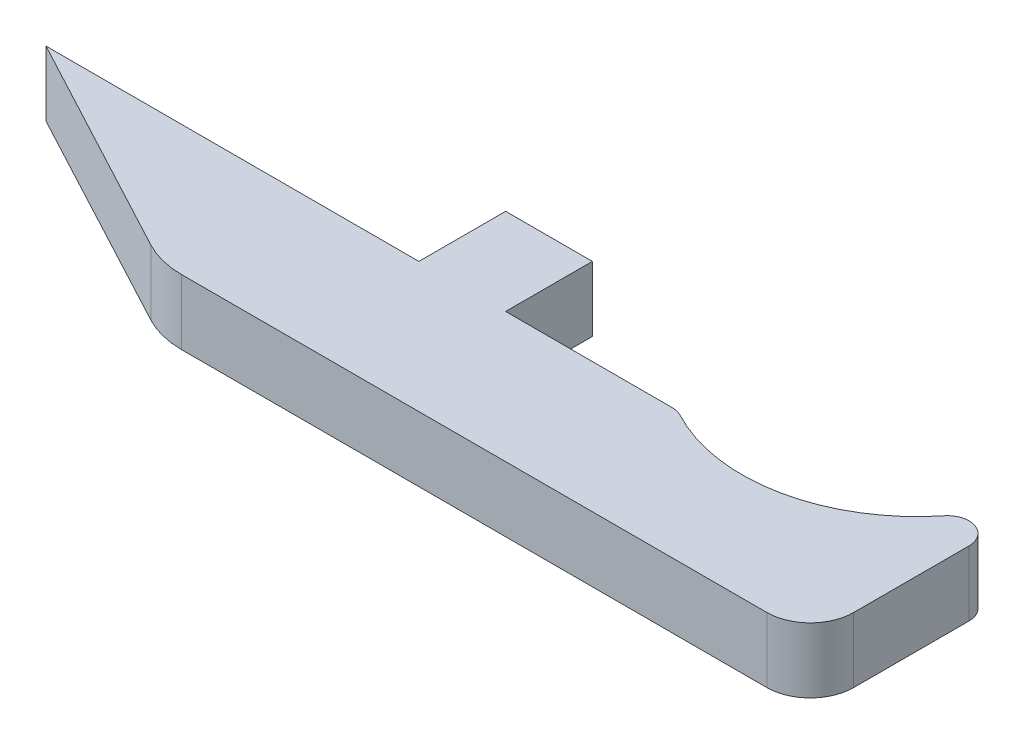
from build123d import *

# Parameters (mm, degrees)
BOSS_EXTRUDE1_DEPTH = 4.7625
FILLET1_R           = 1.5875
FILLET2_R           = 6.35
FILLET3_R           = 3.175
SKETCH2_W           = 6.35
SKETCH2_H           = 4.7625
BOSS_EXTRUDE2_DEPTH = 6.35


with BuildPart() as part:
    # Sketch1 → Boss-Extrude1 (new body)
    with BuildSketch(Plane(origin=(0, 0, 0), x_dir=(1, 0, 0), z_dir=(0, 1, 0))):
        with BuildLine():
            ThreePointArc((71.770239996, -32.203530992), (65.371223106, -43.30366442), (52.558738922, -43.328730992))
            Line((52.558738922, -43.328730992), (6.2845, -43.328730992))
            Line((6.2845, -43.328730992), (24.145239996, -52.853730992))
            Line((24.145239996, -52.853730992), (71.770239996, -52.853730992))
            Line((71.770239996, -52.853730992), (71.770239996, -32.203530992))
        make_face()
    extrude(amount=BOSS_EXTRUDE1_DEPTH)

    # Fillet1
    fillet1_edges = [part.edges().sort_by_distance(p)[0] for p in [
        (52.558738922, 2.38125, 43.328730992),
        (71.770239996, 2.38125, 32.203530992),
    ]]
    fillet(fillet1_edges, radius=FILLET1_R)

    # Fillet2
    fillet2_edges = [part.edges().sort_by_distance(p)[0] for p in [
        (24.145239996, 2.38125, 52.853730992),
    ]]
    fillet(fillet2_edges, radius=FILLET2_R)

    # Fillet3
    fillet3_edges = [part.edges().sort_by_distance(p)[0] for p in [
        (71.770239996, 2.38125, 52.853730992),
    ]]
    fillet(fillet3_edges, radius=FILLET3_R)

    # Sketch2 → Boss-Extrude2 (add)
    with BuildSketch(Plane(origin=(0, 0, 43.328730992), x_dir=(-1, 0, 0), z_dir=(0, 0, -1))):
        with Locations((-36.7645, 2.38125)):
            Rectangle(SKETCH2_W, SKETCH2_H)
    extrude(amount=BOSS_EXTRUDE2_DEPTH)


solid = part.part
